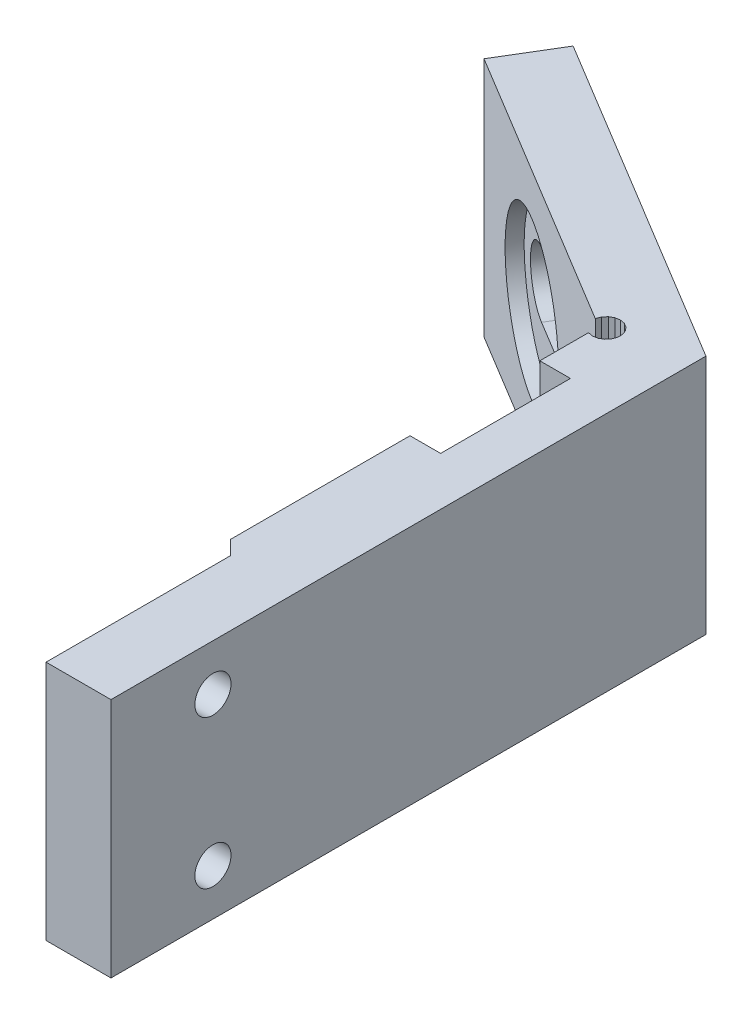
from build123d import *

# Parameters (mm, degrees)
LEG_AND_PAD_DEPTH          = 13
SCREW_HEAD_RELIEF_SKETCH_W = 14
SCREW_HEAD_RELIEF_SKETCH_H = 6
SCREW_HEAD_RELIEF_DEPTH    = 2.35
M6_SLOT_MIDDLE_DEPTH       = 3.5
SCREW_HOLES_SKETCH_R       = 1.95
SCREW_HOLES_DEPTH          = 4.5


with BuildPart() as part:
    # leg and pad sketch → leg and pad (new, symmetric)
    with BuildSketch(Plane(origin=(0, -20.7, 0), x_dir=(1, 0, 0), z_dir=(0, 1, 0))):
        Polygon((-0.551289683, 30.332713936), (-0.367250577, 30.819395741), (-0.028023026, 31.213926146), (0.425575667, 31.468833575), (0.938966578, 31.553446481), (1.450376329, 31.457583879), (1.898269923, 31.192780366), (2.228754897, 30.790898227), (2.402065893, 30.30029363), (2.397349395, 29.779998208), (2.215172912, 29.292616119), (1.877456693, 28.896791249), (1.424836191, 28.640150931), (0.91177263, 28.55357522), (0.4, 28.647481273), (0.4, -9.98), (1.92, -11.5), (1.92, -31.37), (8.92, -31.37), (8.92, 32.792642706), (-27.204821487, 54.594667874), (-30.821788068, 48.601542416), align=None)
    extrude(amount=LEG_AND_PAD_DEPTH, both=True)

    # screw head relief sketch → screw head relief (cut, symmetric)
    with BuildSketch(Plane(origin=(1.35, 0, 0), x_dir=(0, 0, -1), z_dir=(1, 0, 0))):
        with Locations((16.4, -9.7)):
            Rectangle(SCREW_HEAD_RELIEF_SKETCH_W, SCREW_HEAD_RELIEF_SKETCH_H)
    extrude(amount=SCREW_HEAD_RELIEF_DEPTH, both=True, mode=Mode.SUBTRACT)

    # insert flange relief sketch → insert flange relief (revolve, cut)
    with BuildSketch(Plane(origin=(0, -20.7, 0), x_dir=(1, 0, 0), z_dir=(0, 1, 0))):
        Polygon((-18.324853729, 39.891397061), (-17.03307995, 42.03179901), (-9.755713323, 37.639768162), (-11.047487102, 35.499366213), align=None)
    revolve(axis=Axis((-18.324853729, -20.7, -39.891397061), (0.5167095115681243, 0, -0.8561607796757748)), mode=Mode.SUBTRACT)

    # M6 slot end 1 sketch → M6 slot end 1 (revolve, cut)
    with BuildSketch(Plane(origin=(0, -20.7, 0), x_dir=(1, 0, 0), z_dir=(0, 1, 0))):
        Polygon((-20.893336068, 41.441525596), (-16.242950464, 49.146972613), (-13.246387735, 47.338489322), (-17.896773339, 39.633042305), align=None)
    revolve(axis=Axis((-20.893336068, -20.7, -41.441525596), (0.5167095115681233, 0, -0.8561607796757753)), mode=Mode.SUBTRACT)

    # M6 slot end 2 sketch → M6 slot end 2 (revolve, cut)
    with BuildSketch(Plane(origin=(0, -20.7, 0), x_dir=(1, 0, 0), z_dir=(0, 1, 0))):
        Polygon((-15.75637139, 38.341268526), (-11.105985786, 46.046715543), (-8.109423057, 44.238232253), (-12.759808661, 36.532785236), align=None)
    revolve(axis=Axis((-15.75637139, -20.7, -38.341268526), (0.5167095115681234, 0, -0.8561607796757752)), mode=Mode.SUBTRACT)

    # M6 slot middle sketch → M6 slot middle (cut, symmetric)
    with BuildSketch(Plane(origin=(0, -20.7, 0), x_dir=(1, 0, 0), z_dir=(0, 1, 0))):
        Polygon((-15.75637139, 38.341268526), (-20.893336068, 41.441525596), (-16.242950464, 49.146972613), (-11.105985786, 46.046715543), align=None)
    extrude(amount=M6_SLOT_MIDDLE_DEPTH, both=True, mode=Mode.SUBTRACT)

    # screw holes sketch → screw holes (cut, symmetric)
    with BuildSketch(Plane(origin=(5.42, 0, 0), x_dir=(0, 0, -1), z_dir=(1, 0, 0))):
        with Locations((-20.375, -28.7)):
            Circle(SCREW_HOLES_SKETCH_R)
        with Locations((-20.375, -12.7)):
            Circle(SCREW_HOLES_SKETCH_R)
    extrude(amount=SCREW_HOLES_DEPTH, both=True, mode=Mode.SUBTRACT)


solid = part.part
